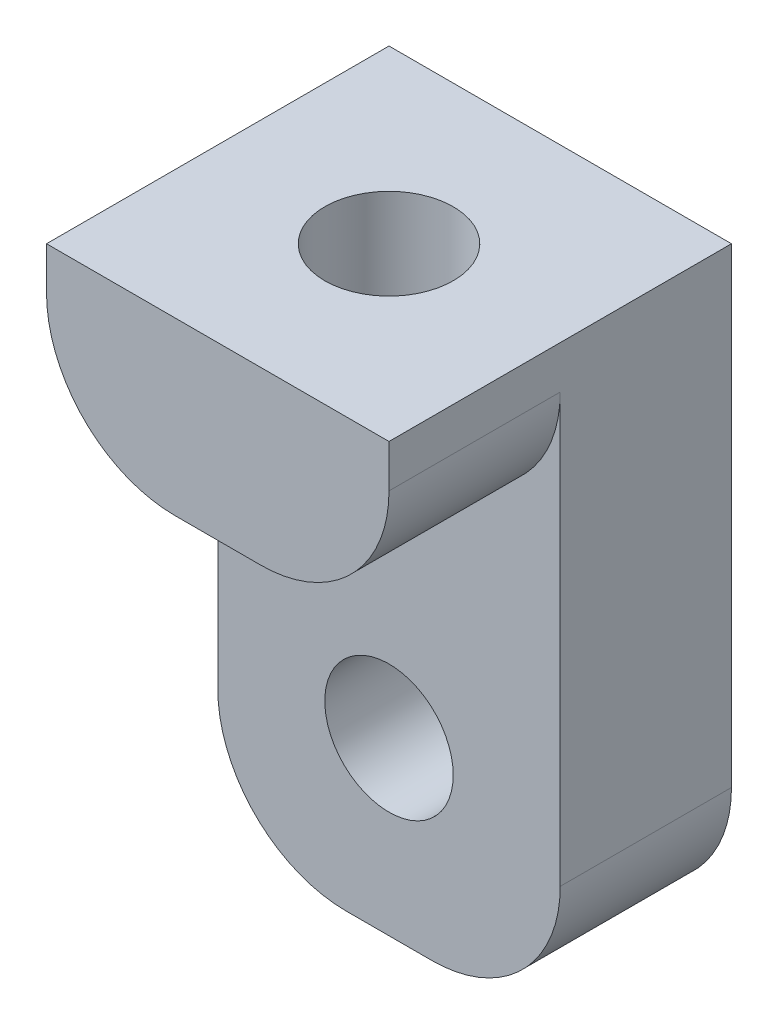
from build123d import *

# Parameters (mm, degrees)
SKETCH1_W           = 40
SKETCH1_H           = 70
SKETCH1_R           = 7.5
BOSS_EXTRUDE1_DEPTH = 40
CUT_EXTRUDE1_DEPTH  = 20
SKETCH3_W           = 40
SKETCH3_H           = 50
CUT_EXTRUDE2_DEPTH  = 20
FILLET1_R           = 15


with BuildPart() as part:
    # Sketch1 → Boss-Extrude1 (new body)
    with BuildSketch(Plane.XY):
        with Locations((0, 15)):
            Rectangle(SKETCH1_W, SKETCH1_H)
        Circle(SKETCH1_R, mode=Mode.SUBTRACT)
    extrude(amount=BOSS_EXTRUDE1_DEPTH)

    # Sketch2 → Cut-Extrude1 (cut)
    with BuildSketch(Plane(origin=(0, 50, 0), x_dir=(1, 0, 0), z_dir=(0, 1, 0))):
        with BuildLine():
            ThreePointArc((7.5, -20), (2.870125743, -13.070903506), (-5.303300859, -14.696699141))
            Line((-5.303300859, -14.696699141), (5.303300859, -25.303300859))
            ThreePointArc((5.303300859, -25.303300859), (6.929096494, -22.870125743), (7.5, -20))
        make_face()
        with BuildLine():
            Line((5.303300859, -25.303300859), (-5.303300859, -14.696699141))
            ThreePointArc((-5.303300859, -14.696699141), (-5.303300859, -25.303300859), (5.303300859, -25.303300859))
        make_face()
    extrude(amount=-CUT_EXTRUDE1_DEPTH, mode=Mode.SUBTRACT)

    # Sketch3 → Cut-Extrude2 (cut)
    with BuildSketch(Plane.XY.offset(40)):
        with Locations((0, 5)):
            Rectangle(SKETCH3_W, SKETCH3_H)
    extrude(amount=-CUT_EXTRUDE2_DEPTH, mode=Mode.SUBTRACT)

    # Fillet1
    # the kernel refuses this fillet: 15 mm, written as the material it takes off along each edge
    with BuildSketch(Plane(origin=(20, -20, -37.5), x_dir=(0, 1, 0), z_dir=(0, 0, 1))) as fillet1_piece_1:
        with BuildLine():
            CenterArc((FILLET1_R, FILLET1_R), FILLET1_R, 180, 90)
            Line((0, FILLET1_R), (0, 0))
            Line((0, 0), (FILLET1_R, 0))
        make_face()
    extrude(amount=95, mode=Mode.SUBTRACT)
    with BuildSketch(Plane(origin=(-20, -20, -37.5), x_dir=(0, 1, 0), z_dir=(0, 0, 1))) as fillet1_piece_2:
        with BuildLine():
            CenterArc((FILLET1_R, -FILLET1_R), FILLET1_R, 90, 90)
            Line((0, -FILLET1_R), (0, 0))
            Line((0, 0), (FILLET1_R, 0))
        make_face()
    extrude(amount=95, mode=Mode.SUBTRACT)
    with BuildSketch(Plane(origin=(-20, 30, 77.5), x_dir=(0, 1, 0), z_dir=(0, 0, -1))) as fillet1_piece_3:
        with BuildLine():
            CenterArc((FILLET1_R, FILLET1_R), FILLET1_R, 180, 90)
            Line((0, FILLET1_R), (0, 0))
            Line((0, 0), (FILLET1_R, 0))
        make_face()
    extrude(amount=57.5, mode=Mode.SUBTRACT)
    with BuildSketch(Plane(origin=(20, 30, 77.5), x_dir=(0, 1, 0), z_dir=(0, 0, -1))) as fillet1_piece_4:
        with BuildLine():
            CenterArc((FILLET1_R, -FILLET1_R), FILLET1_R, 90, 90)
            Line((0, -FILLET1_R), (0, 0))
            Line((0, 0), (FILLET1_R, 0))
        make_face()
    extrude(amount=57.5, mode=Mode.SUBTRACT)


solid = part.part
